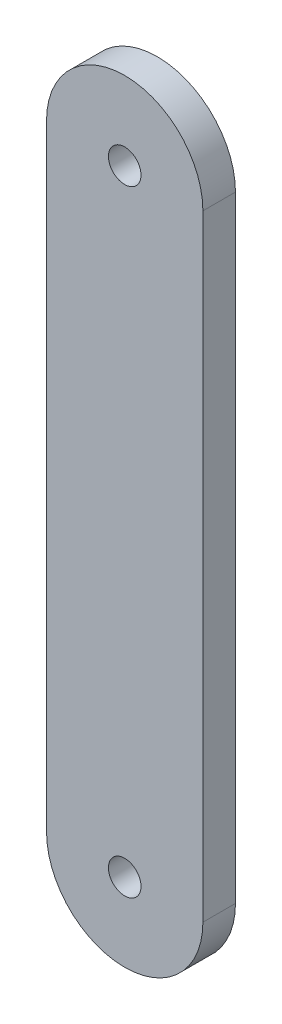
from build123d import *

# Parameters (mm, degrees)
SKETCH_1_R      = 2.5
EXTRUDE_1_DEPTH = 5


with BuildPart() as part:
    # 草图1 → 凸台-拉伸1 (new body)
    with BuildSketch(Plane.XY.offset(5)):
        with BuildLine():
            Line((12, -47.28), (12, 47.28))
            ThreePointArc((12, 47.28), (0, 59.28), (-12, 47.28))
            Line((-12, 47.28), (-12, -47.28))
            ThreePointArc((-12, -47.28), (0, -59.28), (12, -47.28))
        make_face()
        with Locations((0, -47.28)):
            Circle(SKETCH_1_R, mode=Mode.SUBTRACT)
        with Locations((0, 47.28)):
            Circle(SKETCH_1_R, mode=Mode.SUBTRACT)
    extrude(amount=-EXTRUDE_1_DEPTH)


solid = part.part
